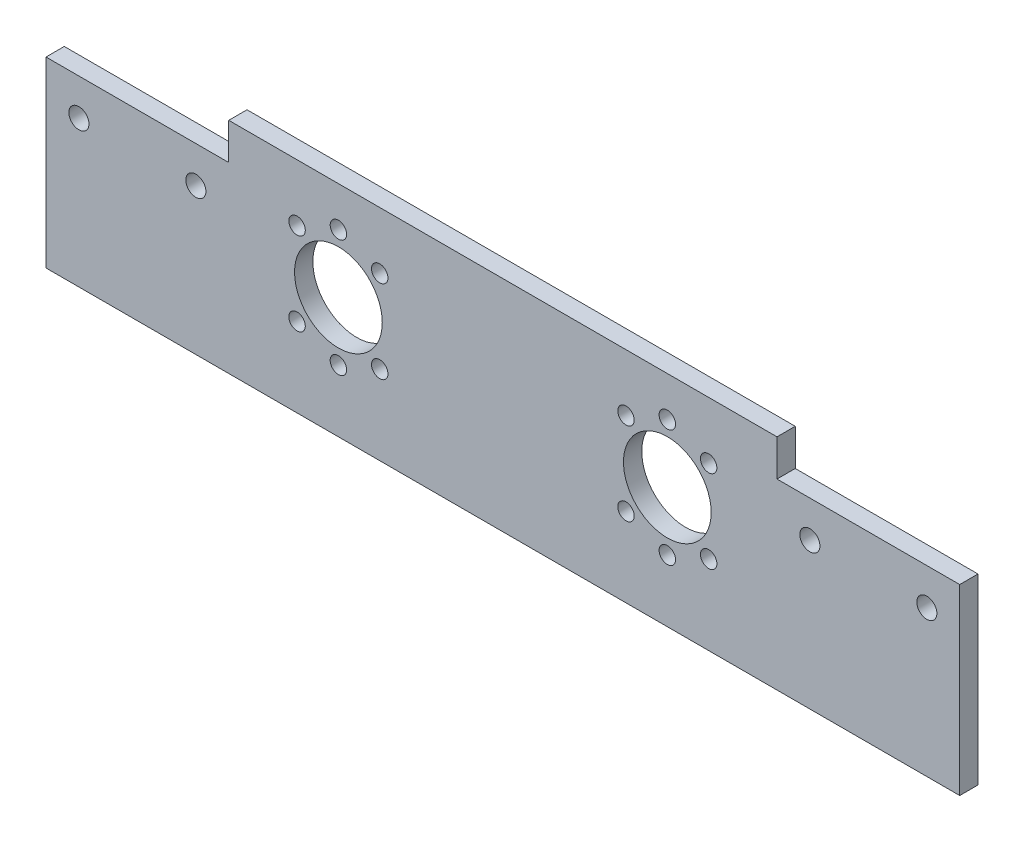
from build123d import *

# Parameters (mm, degrees)
SKETCH_1_W          = 290
SKETCH_1_H          = 50
EXTRUDE_1_DEPTH     = 5
SKETCH_3_W          = 20
SKETCH_3_H          = 50
CUT_EXTRUDE_1_DEPTH = 10
SKETCH_4_W          = 150
SKETCH_4_H          = 5
EXTRUDE_2_DEPTH     = 10
SKETCH_2_R          = 2.25
SKETCH_2_R_2        = 12
CUT_EXTRUDE_2_DEPTH = 2.5
SKETCH_2_2_R        = 2.25
CUT_EXTRUDE_3_DEPTH = 130.903810568
SKETCH_5_R          = 2.75
CUT_EXTRUDE_4_DEPTH = 130.903810568
SKETCH_2_3_R        = 12
CUT_EXTRUDE_5_DEPTH = 10


with BuildPart() as part:
    # 스케치1 → 보스-돌출1 (new body)
    with BuildSketch(Plane.XY):
        Rectangle(SKETCH_1_W, SKETCH_1_H)
    extrude(amount=EXTRUDE_1_DEPTH)

    # 스케치3 → 컷-돌출1 (cut)
    with BuildSketch(Plane.XY.offset(5)):
        with Locations((-135, 0)):
            Rectangle(SKETCH_3_W, SKETCH_3_H)
    cut_extrude_1 = extrude(amount=-CUT_EXTRUDE_1_DEPTH, mode=Mode.SUBTRACT)

    # 대칭 복사1: 컷-돌출1 across plane
    add(cut_extrude_1.mirror(Plane(origin=(0, 0, 0), x_dir=(0, 0, 1), z_dir=(1, 0, 0))), mode=Mode.SUBTRACT)

    # 스케치4 → 보스-돌출2 (add)
    with BuildSketch(Plane(origin=(0, 25, 0), x_dir=(1, 0, 0), z_dir=(0, 1, 0))):
        with Locations((0, -2.5)):
            Rectangle(SKETCH_4_W, SKETCH_4_H)
    extrude(amount=EXTRUDE_2_DEPTH)

    # 스케치2 → 컷-돌출2 (cut)
    with BuildSketch(Plane.XY.offset(5)):
        with Locations((56.308011299, -3.31)):
            Circle(SKETCH_2_R)
        with Locations((33.69, -3.31)):
            Circle(SKETCH_2_R)
        with Locations((44.99900565, -8)):
            Circle(SKETCH_2_R)
        with Locations((56.308011299, 19.4)):
            Circle(SKETCH_2_R)
        with Locations((44.99900565, 24.09)):
            Circle(SKETCH_2_R)
        with Locations((33.69, 19.4)):
            Circle(SKETCH_2_R)
        with Locations((-33.69, 19.4)):
            Circle(SKETCH_2_R)
        with Locations((-44.99900565, 24.09)):
            Circle(SKETCH_2_R)
        with Locations((-56.308011299, 19.4)):
            Circle(SKETCH_2_R)
        with Locations((-44.99900565, -8)):
            Circle(SKETCH_2_R)
        with Locations((-33.69, -3.31)):
            Circle(SKETCH_2_R)
        with Locations((-56.308011299, -3.31)):
            Circle(SKETCH_2_R)
        with Locations((44.99900565, 8.045)):
            Circle(SKETCH_2_R_2)
    extrude(amount=-CUT_EXTRUDE_2_DEPTH, mode=Mode.SUBTRACT)

    # 스케치2<2> → 컷-돌출3 (cut, through all)
    with BuildSketch(Plane.XY.offset(5)):
        with Locations((56.308011299, -3.31)):
            Circle(SKETCH_2_2_R)
        with Locations((33.69, -3.31)):
            Circle(SKETCH_2_2_R)
        with Locations((44.99900565, -8)):
            Circle(SKETCH_2_2_R)
        with Locations((56.308011299, 19.4)):
            Circle(SKETCH_2_2_R)
        with Locations((44.99900565, 24.09)):
            Circle(SKETCH_2_2_R)
        with Locations((33.69, 19.4)):
            Circle(SKETCH_2_2_R)
        with Locations((-33.69, 19.4)):
            Circle(SKETCH_2_2_R)
        with Locations((-44.99900565, 24.09)):
            Circle(SKETCH_2_2_R)
        with Locations((-56.308011299, 19.4)):
            Circle(SKETCH_2_2_R)
        with Locations((-44.99900565, -8)):
            Circle(SKETCH_2_2_R)
        with Locations((-33.69, -3.31)):
            Circle(SKETCH_2_2_R)
        with Locations((-56.308011299, -3.31)):
            Circle(SKETCH_2_2_R)
    extrude(amount=-CUT_EXTRUDE_3_DEPTH, mode=Mode.SUBTRACT)

    # 스케치5 → 컷-돌출4 (cut, through all)
    with BuildSketch(Plane.XY.offset(5)):
        with Locations((-84, 15)):
            Circle(SKETCH_5_R)
        with Locations((-116, 15)):
            Circle(SKETCH_5_R)
        with Locations((116, 15)):
            Circle(SKETCH_5_R)
        with Locations((84, 15)):
            Circle(SKETCH_5_R)
    extrude(amount=-CUT_EXTRUDE_4_DEPTH, mode=Mode.SUBTRACT)

    # 스케치2<3> → 컷-돌출5 (cut)
    with BuildSketch(Plane.XY.offset(5)):
        with Locations((44.99900565, 8.045)):
            Circle(SKETCH_2_3_R)
    cut_extrude_5 = extrude(amount=-CUT_EXTRUDE_5_DEPTH, mode=Mode.SUBTRACT)

    # 대칭 복사2: 컷-돌출5 across plane
    add(cut_extrude_5.mirror(Plane(origin=(0, 0, 0), x_dir=(0, 0, 1), z_dir=(1, 0, 0))), mode=Mode.SUBTRACT)


solid = part.part
